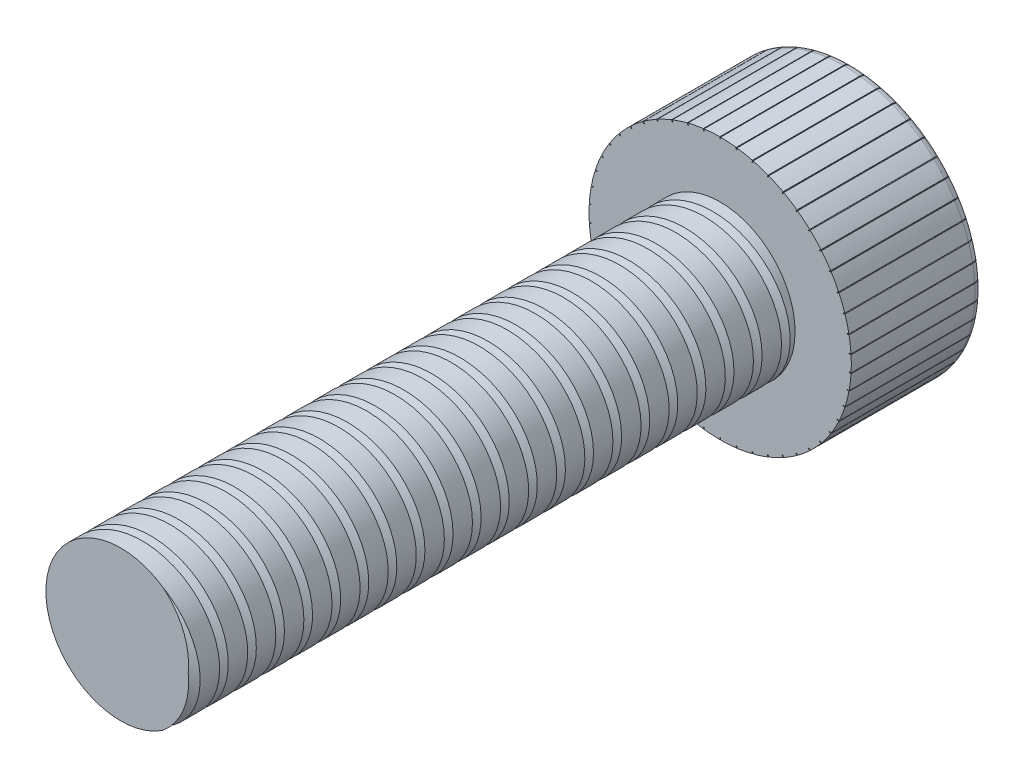
from build123d import *

# Parameters (mm, degrees)
SKETCH1_R           = 3.5
BOSS_EXTRUDE1_DEPTH = 3.5
SKETCH2_R           = 2
BOSS_EXTRUDE2_DEPTH = 16
CUT_EXTRUDE1_DEPTH  = 2.3
FILLET1_R           = 0.2
SKETCH4_W           = 0.02
SKETCH4_H           = 0.55
CUT_EXTRUDE2_DEPTH  = 4
CIRPATTERN1_COUNT   = 50
CUT_SWEEP1_PITCH    = 0.75
CUT_SWEEP1_TO       = 16


with BuildPart() as part:
    # Sketch1 → Boss-Extrude1 (new body)
    with BuildSketch(Plane.XY):
        Circle(SKETCH1_R)
    extrude(amount=BOSS_EXTRUDE1_DEPTH)

    # Sketch2 → Boss-Extrude2 (add)
    with BuildSketch(Plane.XY.offset(3.5)):
        Circle(SKETCH2_R)
    extrude(amount=BOSS_EXTRUDE2_DEPTH)

    # Sketch3 → Cut-Extrude1 (cut)
    with BuildSketch(Plane(origin=(0, 0, 0), x_dir=(-1, 0, 0), z_dir=(0, 0, -1))):
        Polygon((-1.25562218, -1.193068708), (0.40541672, -1.683935059), (1.661038899, -0.490866351), (1.25562218, 1.193068708), (-0.40541672, 1.683935059), (-1.661038899, 0.490866351), align=None)
    extrude(amount=-CUT_EXTRUDE1_DEPTH, mode=Mode.SUBTRACT)

    # Fillet1
    fillet1_edges = [part.edges().sort_by_distance(p)[0] for p in [
        (-3.5, 0, 0),
    ]]
    fillet(fillet1_edges, radius=FILLET1_R)

    # Sketch4 → Cut-Extrude2 (cut)
    with BuildSketch(Plane(origin=(0, 0, 0), x_dir=(-1, 0, 0), z_dir=(0, 0, -1))):
        with Locations((0, 3.725)):
            Rectangle(SKETCH4_W, SKETCH4_H)
    cut_extrude2 = extrude(amount=-CUT_EXTRUDE2_DEPTH, mode=Mode.SUBTRACT)

    # CirPattern1: Cut-Extrude2 ×50 about axis
    cirpattern1_axis = Axis((0, 0, 0), (0, 0, 1))
    for i in range(1, CIRPATTERN1_COUNT):
        add(cut_extrude2.rotate(cirpattern1_axis, i * 360 / CIRPATTERN1_COUNT), mode=Mode.SUBTRACT)

    # Cut-Sweep1: arcs per turn and ends read off the stored shape
    # Cut-Sweep1: the profile of Sketch12 screwed along a right-hand helix through 23 turns, 8 arcs to a turn; built about Z, then put on its axis
    cut_sweep1_z = Axis((0, 0, 0), (0, 0, 1))
    cut_sweep1_corners = [(1.8, 0, -0.75), (2.1, 0, -0.923205081), (2.1, 0, -0.576794919)]
    with BuildLine(mode=Mode.PRIVATE) as cut_sweep1_profile:
        Line(cut_sweep1_corners[0], cut_sweep1_corners[1])
        Line(cut_sweep1_corners[1], cut_sweep1_corners[2])
        Line(cut_sweep1_corners[2], cut_sweep1_corners[0])
    cut_sweep1_cap = Face(cut_sweep1_profile.wire())
    cut_sweep1_turn_angles = [0, 22.5, 45, 67.5, 90, 112.5, 135, 157.5, 180, 202.5, 225, 247.5, 270, 292.5, 315, 337.5, 360]
    cut_sweep1_turn_weights = [1, 0.9238795325112867, 1, 0.9238795325112867, 1, 0.9238795325112867, 1, 0.9238795325112867, 1, 0.9238795325112867, 1, 0.9238795325112867, 1, 0.9238795325112867, 1, 0.9238795325112867, 1]
    cut_sweep1_turn_rails = [Edge.make_bspline([Vector(p[0], p[1], 0).rotate(cut_sweep1_z, cut_sweep1_turn_angles[k]) / cut_sweep1_turn_weights[k] + Vector(0, 0, p[2] + CUT_SWEEP1_PITCH * cut_sweep1_turn_angles[k] / 360) for k in range(17)], [0, 0, 0, 1, 1, 2, 2, 3, 3, 4, 4, 5, 5, 6, 6, 7, 7, 8, 8, 8], 2, cut_sweep1_turn_weights) for p in cut_sweep1_corners]
    cut_sweep1_turn_sides = [Face.make_surface_from_curves(cut_sweep1_turn_rails[p[0]], cut_sweep1_turn_rails[p[1]]) for p in [(0, 1), (1, 2), (2, 0)]]
    cut_sweep1 = Plane(origin=(0, 0, 19.5), x_dir=(1, 0, 0), z_dir=(0, 0, -1)) * split(Solid(Shell([*[p.moved(Location((0, 0, CUT_SWEEP1_PITCH * i))) for i in range(23) for p in cut_sweep1_turn_sides], cut_sweep1_cap, cut_sweep1_cap.rotate(cut_sweep1_z, 8280).moved(Location((0, 0, CUT_SWEEP1_PITCH * 8280 / 360)))])), bisect_by=Plane.XY.offset(CUT_SWEEP1_TO), keep=Keep.BOTTOM, mode=Mode.PRIVATE)
    add(cut_sweep1, mode=Mode.SUBTRACT)


solid = part.part
